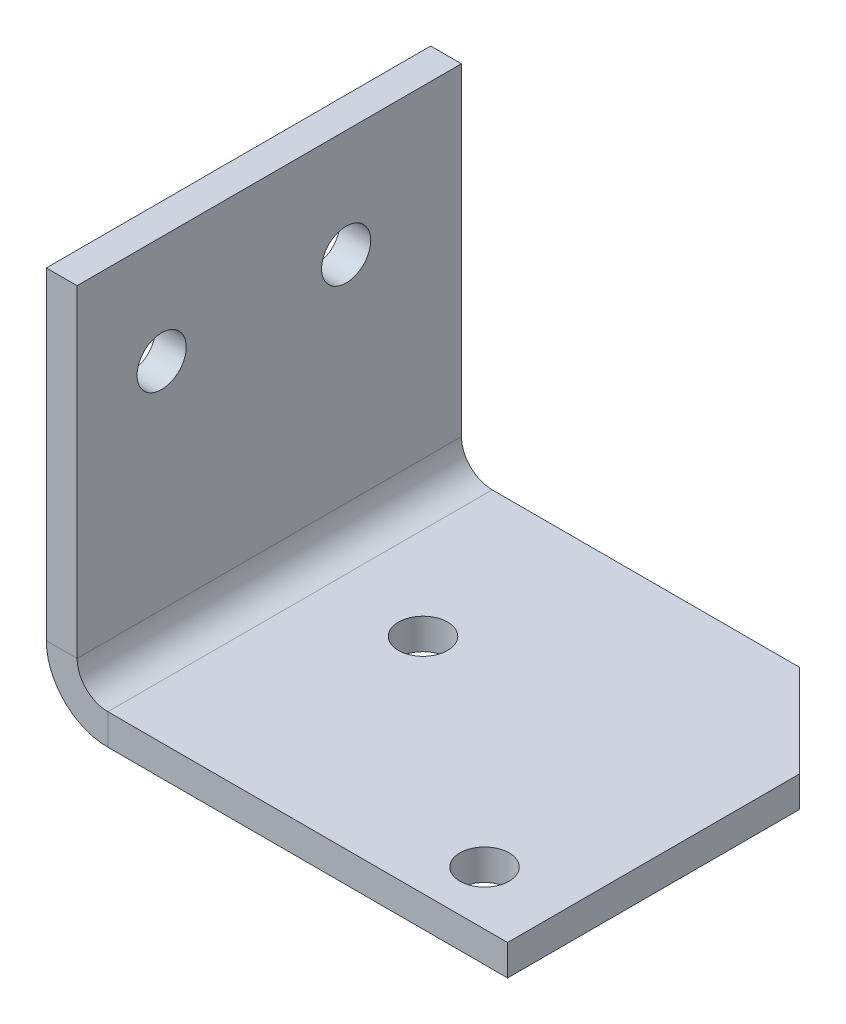
from build123d import *

# Parameters (mm, degrees)
SKETCH5_W                    = 25
SKETCH5_H                    = 25
BASE_FLANGE1_DEPTH           = 2
EDGE_FLANGE1_STRIP_W         = 12
EDGE_FLANGE1_STRIP_H         = 2
EDGE_FLANGE1_STRIP_CUT_DEPTH = 25
EDGE_FLANGE1_DEPTH           = 25
BREAK_CORNER1_START          = 34.648232278
BREAK_CORNER1_OUTLINE_W      = 11
BREAK_CORNER1_OUTLINE_H      = 2
BREAK_CORNER1_DEPTH          = 4.242640687
F_3_2_3_2_DIAMETER_HOLE1_D   = 3.2
F_3_2_3_2_DIAMETER_HOLE2_D   = 3.2


# Read off the part's stored shape, not the designer's step: Break-Corner1
# Sheet-metal steps are written as plain solids
with BuildPart() as part:
    # Sketch5 → Base-Flange1 (new body)
    with BuildSketch(Plane(origin=(0, 0, 0), x_dir=(0, 0, -1), z_dir=(1, 0, 0))):
        with Locations((12.5, 12.5)):
            Rectangle(SKETCH5_W, SKETCH5_H)
    extrude(amount=BASE_FLANGE1_DEPTH)

    # Edge-Flange1 strip (across the edge) → Edge-Flange1 strip cut (cut)
    with BuildSketch(Plane(origin=(2, 0, 0), x_dir=(0, 1, 0), z_dir=(0, 0, -1))):
        with Locations((-2, -1)):
            Rectangle(EDGE_FLANGE1_STRIP_W, EDGE_FLANGE1_STRIP_H)
    extrude(amount=EDGE_FLANGE1_STRIP_CUT_DEPTH, mode=Mode.SUBTRACT)

    # Edge-Flange1 section (across the edge) → Edge-Flange1 (add)
    with BuildSketch(Plane(origin=(2, 0, 0), x_dir=(0, 1, 0), z_dir=(0, 0, -1))):
        with BuildLine():
            Line((0, 2), (0, 28))
            Line((0, 28), (2, 28))
            Line((2, 28), (2, 2))
            ThreePointArc((2, 2), (2.585786438, 0.585786438), (4, 0))
            Line((4, 0), (4, -2))
            ThreePointArc((4, -2), (1.171572875, -0.828427125), (0, 2))
        make_face()
    extrude(amount=EDGE_FLANGE1_DEPTH)

    # Break-Corner1 outline → Break-Corner1 (cut)
    with BuildSketch(Plane(origin=(0, 0, 0), x_dir=(0.7071067811865474, 0, 0.7071067811865477), z_dir=(0.7071067811865476, 0, -0.7071067811865476)).offset(BREAK_CORNER1_START)):
        with Locations((3.5, -1)):
            Rectangle(BREAK_CORNER1_OUTLINE_W, BREAK_CORNER1_OUTLINE_H)
    extrude(amount=BREAK_CORNER1_DEPTH, mode=Mode.SUBTRACT)

    # Ø3.2 (3.2) Diameter Hole1 (through all)
    with Locations(Plane(origin=(2, 0, 0), x_dir=(0, 0, -1), z_dir=(1, 0, 0))):
        with Locations((5.5, 18), (17.5, 18)):
            Hole(F_3_2_3_2_DIAMETER_HOLE1_D / 2)

    # Ø3.2 (3.2) Diameter Hole2 (through all)
    with Locations(Plane(origin=(0, 2, 0), x_dir=(1, 0, 0), z_dir=(0, 1, 0))):
        with Locations((10, 14.5), (25, 3.5)):
            Hole(F_3_2_3_2_DIAMETER_HOLE2_D / 2)


solid = part.part
